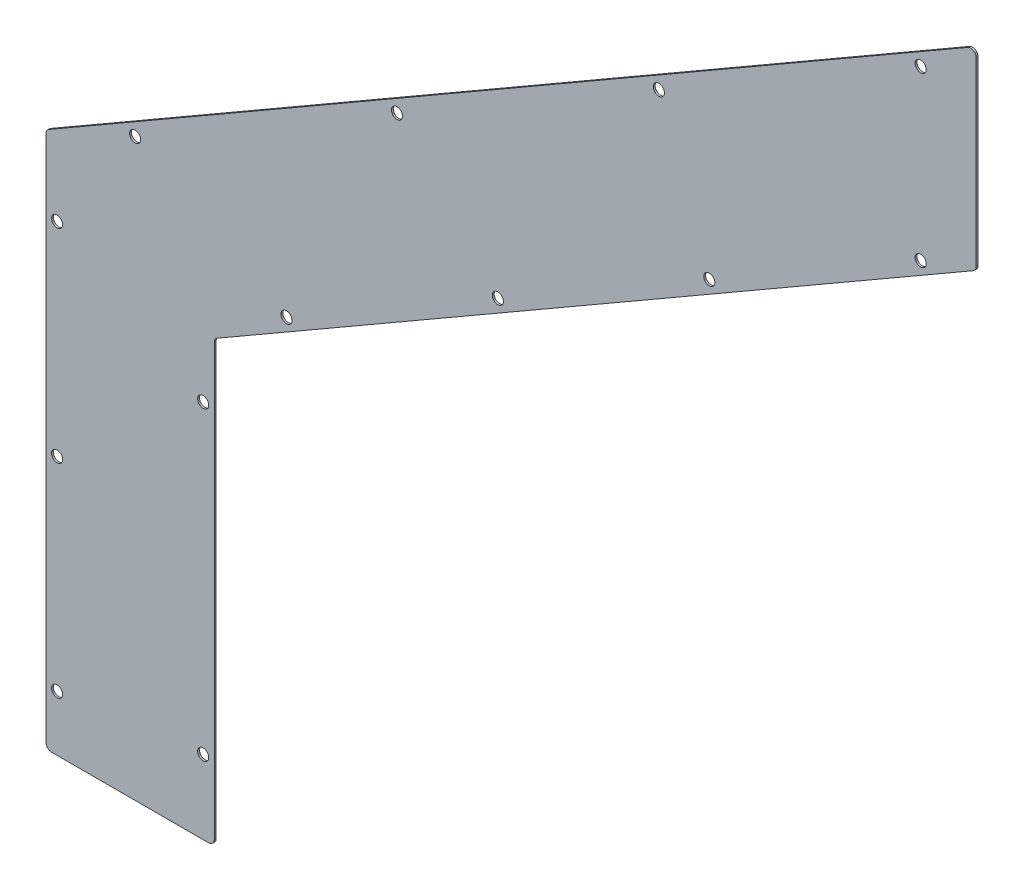
from build123d import *

# Parameters (mm, degrees)
BASE_FLANGE1_DEPTH = 1
FILLET1_R          = 3
SKETCH2_R          = 3
CUT_EXTRUDE1_DEPTH = 10


# Sheet-metal steps are written as plain solids
with BuildPart() as part:
    # Sketch1 → Base-Flange1 (new body)
    with BuildSketch(Plane.XY):
        Polygon((0, 0), (0, 237.736706628), (412, 475.605017534), (412, 580.417185402), (-91, 290.01), (-91, 0), align=None)
    extrude(amount=-BASE_FLANGE1_DEPTH)

    # Fillet1
    fillet1_edges = [part.edges().sort_by_distance(p)[0] for p in [
        (-91, 0, -0.5),
        (-91, 290.01, -0.5),
        (412, 580.417185402, -0.5),
        (412, 475.605017534, -0.5),
        (0, 237.736706628, -0.5),
        (0, 0, -0.5),
    ]]
    fillet(fillet1_edges, radius=FILLET1_R)

    # Sketch2 → Cut-Extrude1 (cut)
    with BuildSketch(Plane(origin=(0, 0, -1), x_dir=(-1, 0, 0), z_dir=(0, 0, -1))):
        with Locations((-382, 556.168474096)):
            Circle(SKETCH2_R)
        with Locations((-240.404846481, 474.418474096)):
            Circle(SKETCH2_R)
        with Locations((-98.809692962, 392.668474096)):
            Circle(SKETCH2_R)
        with Locations((42.785460556, 310.918474096)):
            Circle(SKETCH2_R)
        with Locations((-382, 465.212712688)):
            Circle(SKETCH2_R)
        with Locations((-267.6846467, 399.212712688)):
            Circle(SKETCH2_R)
        with Locations((-153.369293401, 333.212712688)):
            Circle(SKETCH2_R)
        with Locations((-39.053940101, 267.212712688)):
            Circle(SKETCH2_R)
        with Locations((85, 30)):
            Circle(SKETCH2_R)
        with Locations((6, 40)):
            Circle(SKETCH2_R)
        with Locations((85, 140)):
            Circle(SKETCH2_R)
        with Locations((85, 250)):
            Circle(SKETCH2_R)
        with Locations((6, 205)):
            Circle(SKETCH2_R)
    extrude(amount=-CUT_EXTRUDE1_DEPTH, mode=Mode.SUBTRACT)


solid = part.part
